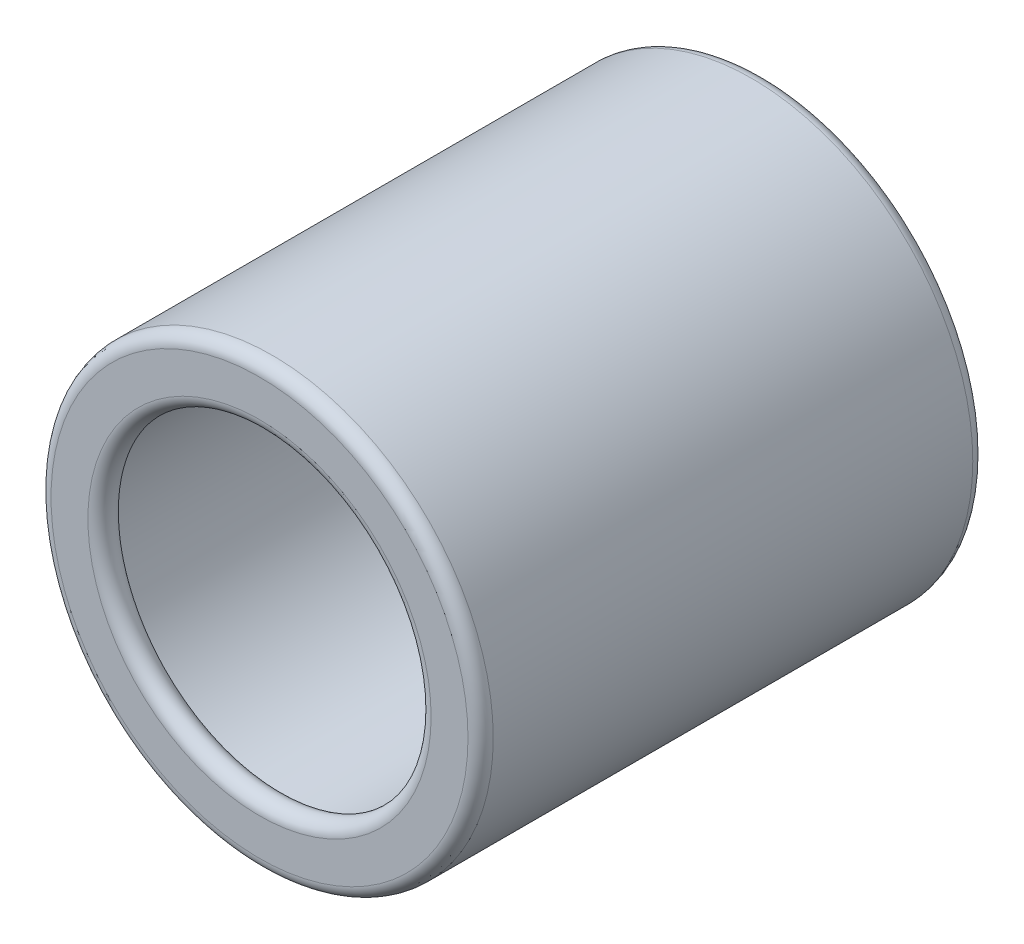
from build123d import *

# Parameters (mm, degrees)
SKETCH1_R           = 13.9065
SKETCH1_R_2         = 10
BOSS_EXTRUDE1_DEPTH = 31.75
FILLET1_R           = 0.79375


# Read off the part's stored shape, not the designer's step: Move Face3
with BuildPart() as part:
    # Sketch1 → Boss-Extrude1 (new body)
    with BuildSketch(Plane.XY):
        Circle(SKETCH1_R)
        Circle(SKETCH1_R_2, mode=Mode.SUBTRACT)
    extrude(amount=BOSS_EXTRUDE1_DEPTH)

    # Fillet1
    fillet1_edges = [part.edges().sort_by_distance(p)[0] for p in [
        (-13.9065, 0, 0),
        (-13.9065, 0, 31.75),
        (-10, 0, 0),
        (-10, 0, 31.75),
    ]]
    fillet(fillet1_edges, radius=FILLET1_R)

    # Move Face3 outline → Move Face3 (revolve, cut)
    with BuildSketch(Plane.XZ):
        with BuildLine():
            Line((10.635, 1.571462993), (10.635, 30.178537007))
            ThreePointArc((10.635, 30.178537007), (10.178913894, 30.454238422), (10, 30.95625))
            Line((10, 30.95625), (10, 0.79375))
            ThreePointArc((10, 0.79375), (10.178913894, 1.295761578), (10.635, 1.571462993))
        make_face()
    revolve(axis=Axis((0, 0, 0), (0, 0, 1)), mode=Mode.SUBTRACT)


solid = part.part
